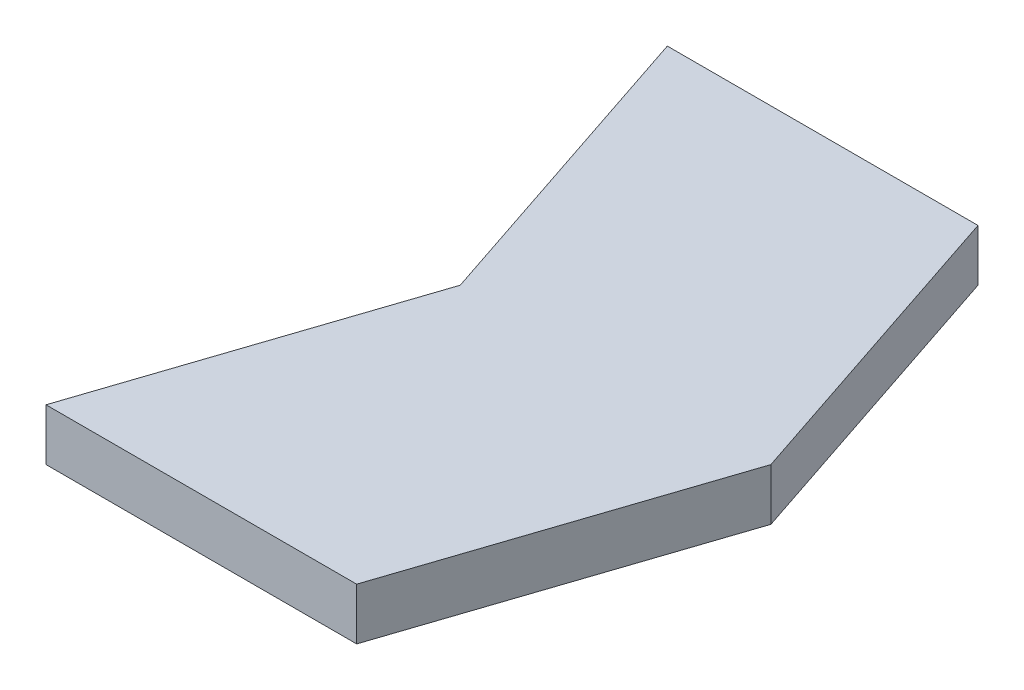
from build123d import *

# Parameters (mm, degrees)
BOSS_EXTRUDE1_DEPTH = 3.175


with BuildPart() as part:
    # Sketch1 → Boss-Extrude1 (new body)
    with BuildSketch(Plane(origin=(0, 0, 0), x_dir=(1, 0, 0), z_dir=(0, 1, 0))):
        Polygon((0, 0), (19.05, 0), (25.4, 19.05), (19.05, 38.1), (0, 38.1), (6.35, 19.05), align=None)
    extrude(amount=BOSS_EXTRUDE1_DEPTH)


solid = part.part
